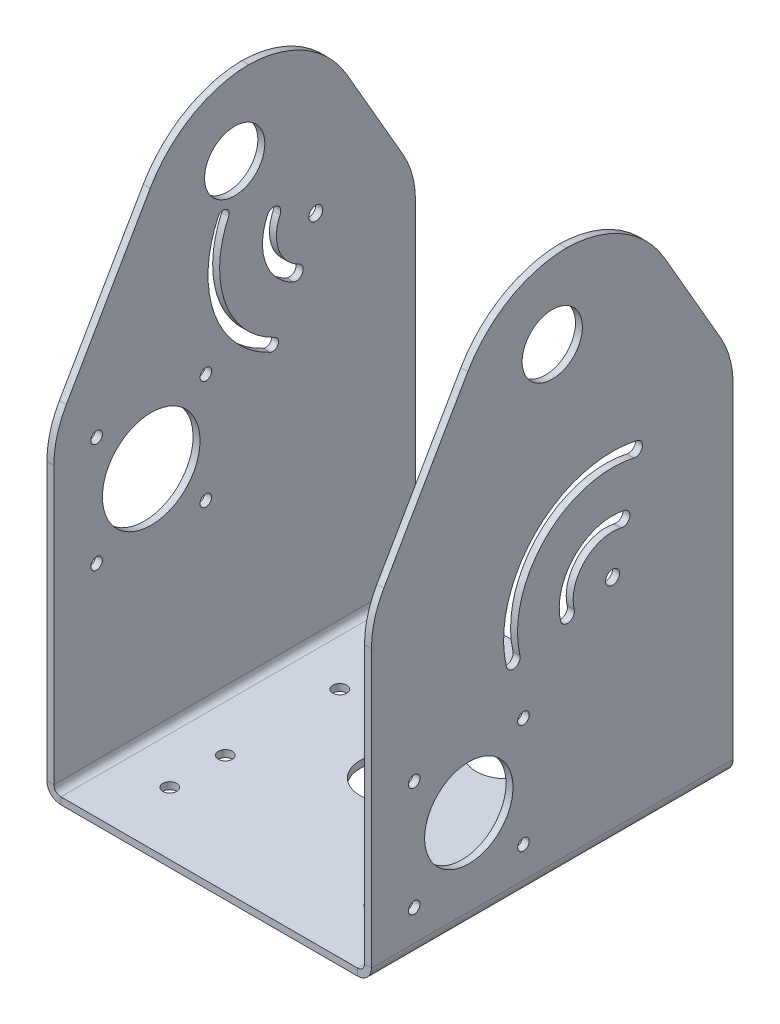
from build123d import *

# Parameters (mm, degrees)
BASE_FLANGE1_DEPTH = 156
SKETCH6_R          = 13
CUT_EXTRUDE1_DEPTH = 312.184832535
SKETCH7_R          = 21.05
SKETCH7_R_2        = 2.5
CUT_EXTRUDE2_DEPTH = 10
SKETCH9_R          = 19.05
SKETCH9_R_2        = 2.5
CUT_EXTRUDE3_DEPTH = 10
SKETCH10_R         = 13
CUT_EXTRUDE4_DEPTH = 10
SKETCH12_R         = 13
CUT_EXTRUDE5_DEPTH = 10
SKETCH14_R         = 3
CUT_EXTRUDE6_DEPTH = 10
SKETCH15_R         = 3
CUT_EXTRUDE7_DEPTH = 10
CUT_EXTRUDE8_DEPTH = 312.184832535
FILLET1_R          = 50
FILLET2_R          = 40
SKETCH16_R         = 3
CUT_EXTRUDE9_DEPTH = 10


# Sheet-metal steps are written as plain solids
with BuildPart() as part:
    # Sketch1 → Base-Flange1 (new body)
    with BuildSketch(Plane.XY):
        with BuildLine():
            Line((-77.380352645, 230), (-77.380352645, 3))
            ThreePointArc((-77.380352645, 3), (-76.501672988, 0.878679656), (-74.380352645, 0))
            Line((-74.380352645, 0), (53.619647355, 0))
            ThreePointArc((53.619647355, 0), (55.740967699, 0.878679656), (56.619647355, 3))
            Line((56.619647355, 3), (56.619647355, 230))
            Line((56.619647355, 230), (59.619647355, 230))
            Line((59.619647355, 230), (59.619647355, 3))
            ThreePointArc((59.619647355, 3), (57.862288042, -1.242640687), (53.619647355, -3))
            Line((53.619647355, -3), (-74.380352645, -3))
            ThreePointArc((-74.380352645, -3), (-78.622993332, -1.242640687), (-80.380352645, 3))
            Line((-80.380352645, 3), (-80.380352645, 230))
            Line((-80.380352645, 230), (-77.380352645, 230))
        make_face()
    extrude(amount=BASE_FLANGE1_DEPTH)

    # Sketch6 → Cut-Extrude1 (cut, through all)
    with BuildSketch(Plane(origin=(59.619647355, 0, 0), x_dir=(0, 0, -1), z_dir=(1, 0, 0))):
        with Locations((-78, 197)):
            Circle(SKETCH6_R)
    extrude(amount=-CUT_EXTRUDE1_DEPTH, mode=Mode.SUBTRACT)

    # Sketch7 → Cut-Extrude2 (cut)
    with BuildSketch(Plane.ZY.offset(80.380352645)):
        with Locations(Location((114, 100, 0), (0, 0, 270))):
            Circle(SKETCH7_R)
        with Locations(Location((90.43, 123.57, 0), (0, 0, 270))):
            Circle(SKETCH7_R_2)
        with Locations(Location((137.57, 123.57, 0), (0, 0, 270))):
            Circle(SKETCH7_R_2)
        with Locations(Location((137.57, 76.43, 0), (0, 0, 270))):
            Circle(SKETCH7_R_2)
        with Locations(Location((90.43, 76.43, 0), (0, 0, 270))):
            Circle(SKETCH7_R_2)
    extrude(amount=-CUT_EXTRUDE2_DEPTH, mode=Mode.SUBTRACT)

    # Sketch9 → Cut-Extrude3 (cut)
    with BuildSketch(Plane(origin=(59.619647355, 0, 0), x_dir=(0, 0, -1), z_dir=(1, 0, 0))):
        with Locations((-114, 40)):
            Circle(SKETCH9_R)
        with Locations((-90.43, 63.57)):
            Circle(SKETCH9_R_2)
        with Locations((-137.57, 63.57)):
            Circle(SKETCH9_R_2)
        with Locations((-137.57, 16.43)):
            Circle(SKETCH9_R_2)
        with Locations((-90.43, 16.43)):
            Circle(SKETCH9_R_2)
    extrude(amount=-CUT_EXTRUDE3_DEPTH, mode=Mode.SUBTRACT)

    # Sketch10 → Cut-Extrude4 (cut)
    with BuildSketch(Plane(origin=(0, 0, 0), x_dir=(1, 0, 0), z_dir=(0, 1, 0))):
        with Locations(Location((-10.380352645, -78, 0), (0, 0, 270))):
            Circle(SKETCH10_R)
    extrude(amount=-CUT_EXTRUDE4_DEPTH, mode=Mode.SUBTRACT)

    # Sketch12 → Cut-Extrude5 (cut)
    with BuildSketch(Plane.XZ.offset(3)):
        with Locations(Location((5.789398738, 44.000000006, 0), (0, 0, 270))):
            Circle(SKETCH12_R)
    extrude(amount=-CUT_EXTRUDE5_DEPTH, mode=Mode.SUBTRACT)

    # Sketch14 → Cut-Extrude6 (cut)
    with BuildSketch(Plane(origin=(59.619647355, 0, 0), x_dir=(0, 0, -1), z_dir=(1, 0, 0))):
        with Locations((-52, 97)):
            Circle(SKETCH14_R)
        with BuildLine():
            ThreePointArc((-46.82612575, 119.41051149), (-68.263455967, 113.263455967), (-74.41051149, 91.82612575))
            ThreePointArc((-74.41051149, 91.82612575), (-70.812548133, 89.577868719), (-68.564291101, 93.175832076))
            ThreePointArc((-68.564291101, 93.175832076), (-64.02081528, 109.02081528), (-48.175832076, 113.564291101))
            ThreePointArc((-48.175832076, 113.564291101), (-44.577868719, 115.812548133), (-46.82612575, 119.41051149))
        make_face()
        with BuildLine():
            ThreePointArc((-41.427300446, 142.795393045), (-85.234018716, 130.234018716), (-97.795393045, 86.427300446))
            ThreePointArc((-97.795393045, 86.427300446), (-94.197429688, 84.179043415), (-91.949172656, 87.777006772))
            ThreePointArc((-91.949172656, 87.777006772), (-80.991378029, 125.991378029), (-42.777006772, 136.949172656))
            ThreePointArc((-42.777006772, 136.949172656), (-39.179043415, 139.197429688), (-41.427300446, 142.795393045))
        make_face()
    extrude(amount=-CUT_EXTRUDE6_DEPTH, mode=Mode.SUBTRACT)

    # Sketch15 → Cut-Extrude7 (cut)
    with BuildSketch(Plane(origin=(-77.380352645, 0, 0), x_dir=(0, 0, -1), z_dir=(1, 0, 0))):
        with Locations(Location((-43, 160, 0), (0, 0, 90))):
            Circle(SKETCH15_R)
        with BuildLine():
            ThreePointArc((-85.143312097, 179.651749171), (-86.695706867, 144.096063335), (-62.651749171, 117.856687903))
            ThreePointArc((-62.651749171, 117.856687903), (-59.329434049, 119.065911716), (-60.538657862, 122.388226838))
            ThreePointArc((-60.538657862, 122.388226838), (-81.997243763, 145.806164052), (-80.611773162, 177.538657862))
            ThreePointArc((-80.611773162, 177.538657862), (-81.820996975, 180.860972984), (-85.143312097, 179.651749171))
        make_face()
        with BuildLine():
            ThreePointArc((-63.845079102, 169.72022002), (-64.612930278, 152.133536704), (-52.72022002, 139.154920898))
            ThreePointArc((-52.72022002, 139.154920898), (-48.733441874, 140.605989474), (-50.18451045, 144.59276762))
            ThreePointArc((-50.18451045, 144.59276762), (-58.974774553, 154.185657563), (-58.40723238, 167.18451045))
            ThreePointArc((-58.40723238, 167.18451045), (-59.858300956, 171.171288596), (-63.845079102, 169.72022002))
        make_face()
    extrude(amount=-CUT_EXTRUDE7_DEPTH, mode=Mode.SUBTRACT)

    # Sketch13 → Cut-Extrude8 (cut, through all)
    with BuildSketch(Plane(origin=(59.619647355, 0, 0), x_dir=(0, 0, -1), z_dir=(1, 0, 0))):
        Polygon((-100, 230), (-156, 133.005154776), (-156, 230), align=None)
        Polygon((-44, 230), (0, 153.789764467), (0, 230), align=None)
    extrude(amount=-CUT_EXTRUDE8_DEPTH, mode=Mode.SUBTRACT)

    # Fillet1
    # the kernel refuses this fillet: 50 mm, written as the material it takes off along each edge
    with BuildSketch(Plane(origin=(131.788431004, 230, 44), x_dir=(0, -0.8660254037844418, -0.49999999999999445), z_dir=(-1, 0, 0)), Plane(origin=(-5.211568996, 230, 44), x_dir=(0, -0.8660254037844418, -0.49999999999999445), z_dir=(-1, 0, 0))) as fillet1_piece_1:
        with BuildLine():
            CenterArc((FILLET1_R * 0.57735026919, FILLET1_R), FILLET1_R, 210, 60)
            Line((-FILLET1_R * 0.288675134595, FILLET1_R * 0.5), (0, 0))
            Line((0, 0), (FILLET1_R * 0.57735026919, 0))
        make_face()
    extrude(amount=147.337567297, mode=Mode.SUBTRACT)
    with BuildSketch(Plane(origin=(-5.211568996, 230, 100), x_dir=(0, -0.8660254037844418, 0.49999999999999445), z_dir=(-1, 0, 0)), Plane(origin=(131.788431004, 230, 100), x_dir=(0, -0.8660254037844418, 0.49999999999999445), z_dir=(-1, 0, 0))) as fillet1_piece_2:
        with BuildLine():
            CenterArc((FILLET1_R * 0.57735026919, -FILLET1_R), FILLET1_R, 90, 60)
            Line((-FILLET1_R * 0.288675134595, -FILLET1_R * 0.5), (0, 0))
            Line((0, 0), (FILLET1_R * 0.57735026919, 0))
        make_face()
    extrude(amount=147.337567297, mode=Mode.SUBTRACT)

    # Fillet2
    fillet2_edges = [part.edges().sort_by_distance(p)[0] for p in [
        (58.119647355, 153.789764467, 0),
        (58.119647355, 133.005154776, 156),
        (-78.880352645, 133.005154776, 156),
        (-78.880352645, 153.789764467, 0),
    ]]
    fillet(fillet2_edges, radius=FILLET2_R)

    # Sketch16 → Cut-Extrude9 (cut)
    with BuildSketch(Plane.XZ.offset(3)):
        with Locations(Location((-54.380352645, 129, 0), (0, 0, 270))):
            Circle(SKETCH16_R)
        with Locations(Location((-54.380352645, 105, 0), (0, 0, 270))):
            Circle(SKETCH16_R)
        with Locations(Location((-54.380352645, 55.647353532, 0), (0, 0, 270))):
            Circle(SKETCH16_R)
        with Locations(Location((-54.380352645, 31.647353532, 0), (0, 0, 270))):
            Circle(SKETCH16_R)
        with Locations(Location((33.619647355, 129, 0), (0, 0, 270))):
            Circle(SKETCH16_R)
        with Locations(Location((33.619647355, 105, 0), (0, 0, 270))):
            Circle(SKETCH16_R)
        with Locations(Location((33.619647355, 55.647353532, 0), (0, 0, 270))):
            Circle(SKETCH16_R)
        with Locations(Location((33.619647355, 31.647353532, 0), (0, 0, 270))):
            Circle(SKETCH16_R)
    extrude(amount=-CUT_EXTRUDE9_DEPTH, mode=Mode.SUBTRACT)


solid = part.part
